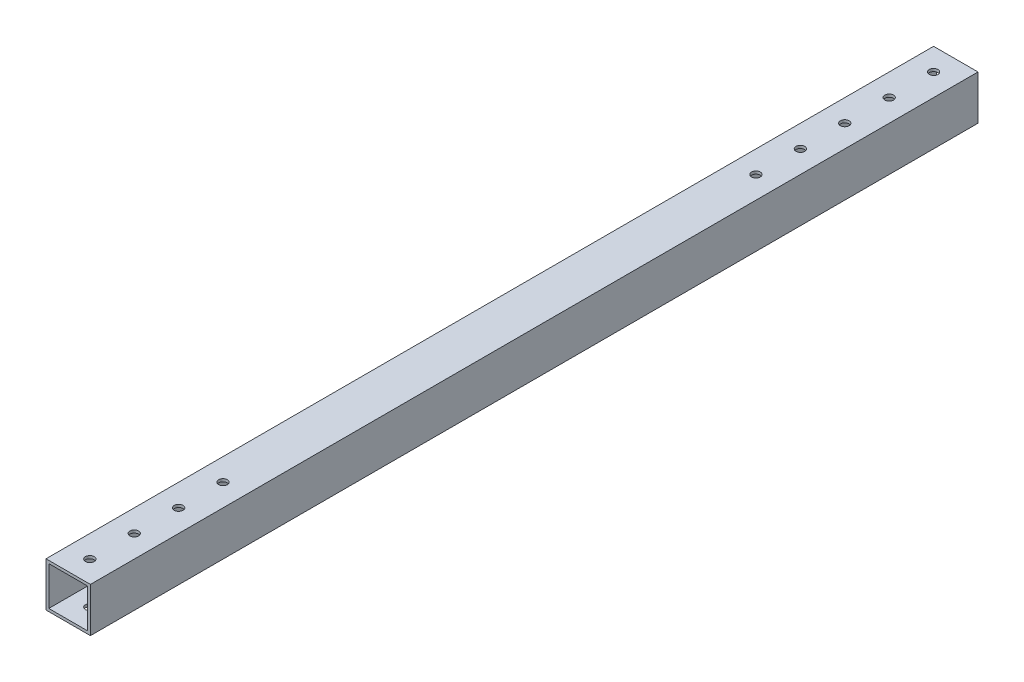
from build123d import *

# Parameters (mm, degrees)
SKETCH1_W               = 25.4
SKETCH1_H               = 25.4
BOSS_EXTRUDE1_DEPTH     = 253.836899361
SHELL1_T                = -1.5875
CUT_EXTRUDE1_DEPTH      = 255.471514078
CUT_EXTRUDE1_DEPTH_BACK = 255.471514078
SKETCH3_R               = 2.4892


with BuildPart() as part:
    # Sketch1 → Boss-Extrude1 (new, symmetric)
    with BuildSketch(Plane.XY):
        Rectangle(SKETCH1_W, SKETCH1_H)
    extrude(amount=BOSS_EXTRUDE1_DEPTH, both=True)

    # Shell1
    shell1_openings = [part.faces().sort_by_distance(p)[0] for p in [
        (0, 0, -253.836899361),
        (0, 0, 253.836899361),
    ]]
    offset(amount=SHELL1_T, openings=shell1_openings, kind=Kind.INTERSECTION)

    # Sketch3 → Cut-Extrude1 (cut, two sides: drawn at the far end of the back side and taken through both)
    with BuildSketch(Plane(origin=(0, 0, 0), x_dir=(1, 0, 0), z_dir=(0, 1, 0)).offset(-CUT_EXTRUDE1_DEPTH_BACK)):
        with Locations((0, 241.136899361)):
            Circle(SKETCH3_R)
        with Locations((0, 215.736899361)):
            Circle(SKETCH3_R)
        with Locations((0, 190.336899361)):
            Circle(SKETCH3_R)
        with Locations((0, 164.936899361)):
            Circle(SKETCH3_R)
        with Locations((0, 139.536899361)):
            Circle(SKETCH3_R)
        with Locations((0, -165.263100639)):
            Circle(SKETCH3_R)
        with Locations((0, -190.663100639)):
            Circle(SKETCH3_R)
        with Locations((0, -216.063100639)):
            Circle(SKETCH3_R)
        with Locations((0, -241.463100639)):
            Circle(SKETCH3_R)
    extrude(amount=CUT_EXTRUDE1_DEPTH + CUT_EXTRUDE1_DEPTH_BACK, mode=Mode.SUBTRACT)


solid = part.part
